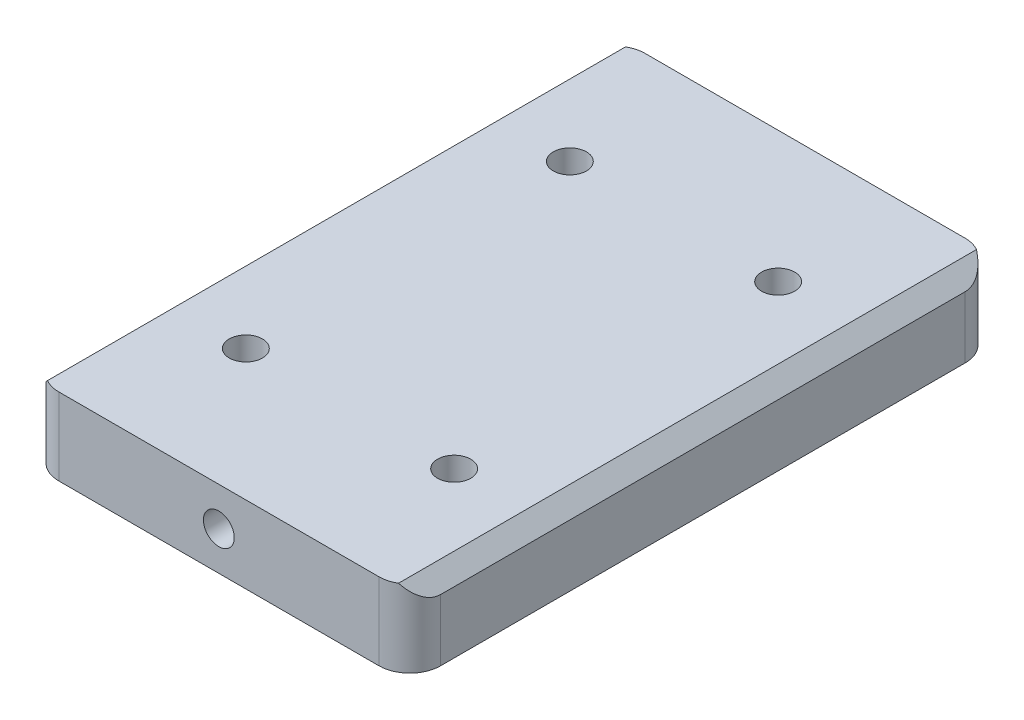
from build123d import *

# Parameters (mm, degrees)
BASE_W              = 24.75
BASE_H              = 38
BASE_R              = 1.075
BOSS_EXTRUDE1_DEPTH = 5
SKETCH1_3_R         = 1.075
CUT_EXTRUDE1_DEPTH  = 2
SKETCH1_5_R         = 1.075
CUT_EXTRUDE2_DEPTH  = 24.219401909
FILLET1_R           = 2
CHAMFER1_SIZE       = 1
MOUNT_HOLE_R        = 1
CUT_EXTRUDE3_DEPTH  = 7.5


with BuildPart() as part:
    # Base → Boss-Extrude1 (new body)
    # profile 1 of 9: a face of its own
    with BuildSketch(Plane(origin=(0, 0, 0), x_dir=(1, 0, 0), z_dir=(0, 1, 0))):
        Rectangle(BASE_W, BASE_H)
        Polygon((-6.75, -12.809401077), (-4.75, -11.654700538), (-4.75, -9.345299462), (-6.75, -8.190598923), (-8.75, -9.345299462), (-8.75, -11.654700538), align=None, mode=Mode.SUBTRACT)
        Polygon((6.75, -12.809401077), (8.75, -11.654700538), (8.75, -9.345299462), (6.75, -8.190598923), (4.75, -9.345299462), (4.75, -11.654700538), align=None, mode=Mode.SUBTRACT)
        Polygon((8.75, 9.345299462), (8.75, 11.654700538), (6.75, 12.809401077), (4.75, 11.654700538), (4.75, 9.345299462), (6.75, 8.190598923), align=None, mode=Mode.SUBTRACT)
        Polygon((-6.75, 8.190598923), (-4.75, 9.345299462), (-4.75, 11.654700538), (-6.75, 12.809401077), (-8.75, 11.654700538), (-8.75, 9.345299462), align=None, mode=Mode.SUBTRACT)
    # profile 2 of 9: a face of its own
    with BuildSketch(Plane(origin=(0, 0, 0), x_dir=(1, 0, 0), z_dir=(0, 1, 0))):
        Polygon((4.75, -11.654700538), (6.75, -12.809401077), (8.75, -11.654700538), (8.75, -9.345299462), (6.75, -8.190598923), (4.75, -9.345299462), align=None)
        with Locations((6.75, -10.5)):
            Circle(BASE_R, mode=Mode.SUBTRACT)
    # profile 3 of 9: a face of its own
    with BuildSketch(Plane(origin=(0, 0, 0), x_dir=(1, 0, 0), z_dir=(0, 1, 0))):
        with Locations((6.75, -10.5)):
            Circle(BASE_R)
    # profile 4 of 9: a face of its own
    with BuildSketch(Plane(origin=(0, 0, 0), x_dir=(1, 0, 0), z_dir=(0, 1, 0))):
        Polygon((6.75, 8.190598923), (8.75, 9.345299462), (8.75, 11.654700538), (6.75, 12.809401077), (4.75, 11.654700538), (4.75, 9.345299462), align=None)
        with Locations((6.75, 10.5)):
            Circle(BASE_R, mode=Mode.SUBTRACT)
    # profile 5 of 9: a face of its own
    with BuildSketch(Plane(origin=(0, 0, 0), x_dir=(1, 0, 0), z_dir=(0, 1, 0))):
        Polygon((-8.75, 9.345299462), (-6.75, 8.190598923), (-4.75, 9.345299462), (-4.75, 11.654700538), (-6.75, 12.809401077), (-8.75, 11.654700538), align=None)
        with Locations((-6.75, 10.5)):
            Circle(BASE_R, mode=Mode.SUBTRACT)
    # profile 6 of 9: a face of its own
    with BuildSketch(Plane(origin=(0, 0, 0), x_dir=(1, 0, 0), z_dir=(0, 1, 0))):
        with Locations((-6.75, 10.5)):
            Circle(BASE_R)
    # profile 7 of 9: a face of its own
    with BuildSketch(Plane(origin=(0, 0, 0), x_dir=(1, 0, 0), z_dir=(0, 1, 0))):
        with Locations((6.75, 10.5)):
            Circle(BASE_R)
    # profile 8 of 9: a face of its own
    with BuildSketch(Plane(origin=(0, 0, 0), x_dir=(1, 0, 0), z_dir=(0, 1, 0))):
        Polygon((-8.75, -11.654700538), (-6.75, -12.809401077), (-4.75, -11.654700538), (-4.75, -9.345299462), (-6.75, -8.190598923), (-8.75, -9.345299462), align=None)
        with Locations((-6.75, -10.5)):
            Circle(BASE_R, mode=Mode.SUBTRACT)
    # profile 9 of 9: a face of its own
    with BuildSketch(Plane(origin=(0, 0, 0), x_dir=(1, 0, 0), z_dir=(0, 1, 0))):
        with Locations((-6.75, -10.5)):
            Circle(BASE_R)
    extrude(amount=BOSS_EXTRUDE1_DEPTH)

    # Sketch1<3> → Cut-Extrude1 (cut)
    # profile 1 of 8: a face of its own
    with BuildSketch(Plane(origin=(0, 0, 0), x_dir=(1, 0, 0), z_dir=(0, 1, 0))):
        Polygon((-8.75, 9.345299462), (-6.75, 8.190598923), (-4.75, 9.345299462), (-4.75, 11.654700538), (-6.75, 12.809401077), (-8.75, 11.654700538), align=None)
        with Locations((-6.75, 10.5)):
            Circle(SKETCH1_3_R, mode=Mode.SUBTRACT)
    # profile 2 of 8: a face of its own
    with BuildSketch(Plane(origin=(0, 0, 0), x_dir=(1, 0, 0), z_dir=(0, 1, 0))):
        with Locations((-6.75, 10.5)):
            Circle(SKETCH1_3_R)
    # profile 3 of 8: a face of its own
    with BuildSketch(Plane(origin=(0, 0, 0), x_dir=(1, 0, 0), z_dir=(0, 1, 0))):
        Polygon((-8.75, -11.654700538), (-6.75, -12.809401077), (-4.75, -11.654700538), (-4.75, -9.345299462), (-6.75, -8.190598923), (-8.75, -9.345299462), align=None)
        with Locations((-6.75, -10.5)):
            Circle(SKETCH1_3_R, mode=Mode.SUBTRACT)
    # profile 4 of 8: a face of its own
    with BuildSketch(Plane(origin=(0, 0, 0), x_dir=(1, 0, 0), z_dir=(0, 1, 0))):
        with Locations((-6.75, -10.5)):
            Circle(SKETCH1_3_R)
    # profile 5 of 8: a face of its own
    with BuildSketch(Plane(origin=(0, 0, 0), x_dir=(1, 0, 0), z_dir=(0, 1, 0))):
        Polygon((4.75, -11.654700538), (6.75, -12.809401077), (8.75, -11.654700538), (8.75, -9.345299462), (6.75, -8.190598923), (4.75, -9.345299462), align=None)
        with Locations((6.75, -10.5)):
            Circle(SKETCH1_3_R, mode=Mode.SUBTRACT)
    # profile 6 of 8: a face of its own
    with BuildSketch(Plane(origin=(0, 0, 0), x_dir=(1, 0, 0), z_dir=(0, 1, 0))):
        with Locations((6.75, -10.5)):
            Circle(SKETCH1_3_R)
    # profile 7 of 8: a face of its own
    with BuildSketch(Plane(origin=(0, 0, 0), x_dir=(1, 0, 0), z_dir=(0, 1, 0))):
        Polygon((6.75, 8.190598923), (8.75, 9.345299462), (8.75, 11.654700538), (6.75, 12.809401077), (4.75, 11.654700538), (4.75, 9.345299462), align=None)
        with Locations((6.75, 10.5)):
            Circle(SKETCH1_3_R, mode=Mode.SUBTRACT)
    # profile 8 of 8: a face of its own
    with BuildSketch(Plane(origin=(0, 0, 0), x_dir=(1, 0, 0), z_dir=(0, 1, 0))):
        with Locations((6.75, 10.5)):
            Circle(SKETCH1_3_R)
    extrude(amount=CUT_EXTRUDE1_DEPTH, mode=Mode.SUBTRACT)

    # Sketch1<5> → Cut-Extrude2 (cut, through all)
    with BuildSketch(Plane(origin=(0, 0, 0), x_dir=(1, 0, 0), z_dir=(0, 1, 0))):
        with Locations(Location((6.75, 10.5, 0), (0, 0, 270))):
            Circle(SKETCH1_5_R)
        with Locations(Location((6.75, -10.5, 0), (0, 0, 270))):
            Circle(SKETCH1_5_R)
        with Locations(Location((-6.75, -10.5, 0), (0, 0, 270))):
            Circle(SKETCH1_5_R)
        with Locations(Location((-6.75, 10.5, 0), (0, 0, 270))):
            Circle(SKETCH1_5_R)
    extrude(amount=CUT_EXTRUDE2_DEPTH, mode=Mode.SUBTRACT)

    # Fillet1
    fillet1_edges = [part.edges().sort_by_distance(p)[0] for p in [
        (12.375, 2.5, 19),
        (-12.375, 2.5, 19),
        (-12.375, 2.5, -19),
        (12.375, 2.5, -19),
    ]]
    fillet(fillet1_edges, radius=FILLET1_R)

    # Chamfer1
    # the kernel refuses this chamfer: 1 mm, written as the material it takes off along each edge
    with BuildSketch(Plane(origin=(12.375, 5, -19.571682988), x_dir=(0.027495876610585623, -0.9996219169112968, 0), z_dir=(0, 0, 1))) as chamfer1_piece_1:
        Polygon((CHAMFER1_SIZE * 0.999621916911, -CHAMFER1_SIZE * 0.0274958766106), (-CHAMFER1_SIZE * 0.0274958766106, -CHAMFER1_SIZE * 0.999621916911), (0, 0), align=None)
    extrude(amount=39.143365976, mode=Mode.SUBTRACT)
    with BuildSketch(Plane(origin=(-12.375, 5, 19.571682988), x_dir=(0.9996219169112968, 0.02749587661058651, 0), z_dir=(0, 0, -1))) as chamfer1_piece_2:
        Polygon((CHAMFER1_SIZE * 0.999621916911, CHAMFER1_SIZE * 0.0274958766106), (-CHAMFER1_SIZE * 0.0274958766106, CHAMFER1_SIZE * 0.999621916911), (0, 0), align=None)
    extrude(amount=39.143365976, mode=Mode.SUBTRACT)

    # Mount_Hole → Cut-Extrude3 (cut)
    with BuildSketch(Plane(origin=(0, 0, -19), x_dir=(-1, 0, 0), z_dir=(0, 0, -1))):
        with Locations((0, 2.5)):
            Circle(MOUNT_HOLE_R)
    cut_extrude3 = extrude(amount=-CUT_EXTRUDE3_DEPTH, mode=Mode.SUBTRACT)

    # Mirror1: Cut-Extrude3 across plane
    add(cut_extrude3.mirror(Plane(origin=(0, 0, 0), x_dir=(1, 0, 0), z_dir=(0, 0, -1))), mode=Mode.SUBTRACT)


solid = part.part
